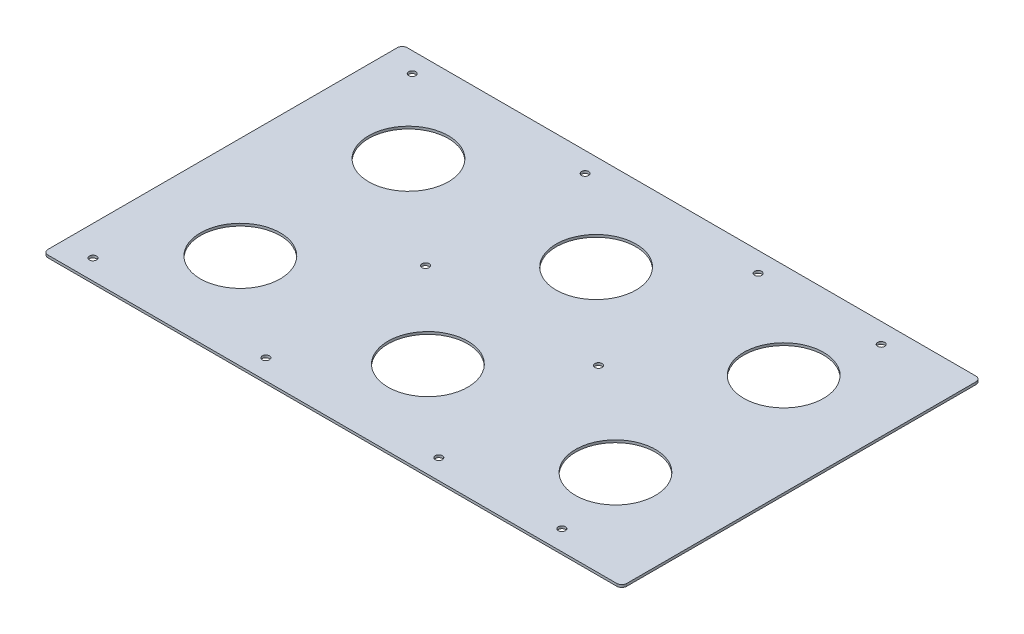
from build123d import *

# Parameters (mm, degrees)
SKETCH1_R           = 25.4
SKETCH1_R_2         = 2.2479
BOSS_EXTRUDE1_DEPTH = 1.5748


with BuildPart() as part:
    # Sketch1 → Boss-Extrude1 (new body)
    with BuildSketch(Plane(origin=(0, 0, 0), x_dir=(1, 0, 0), z_dir=(0, 1, 0))):
        with BuildLine():
            Line((-180.975, -114.3), (180.975, -114.3))
            ThreePointArc((180.975, -114.3), (183.22006403, -113.37006403), (184.15, -111.125))
            Line((184.15, -111.125), (184.15, 111.125))
            ThreePointArc((184.15, 111.125), (183.22006403, 113.37006403), (180.975, 114.3))
            Line((180.975, 114.3), (-180.975, 114.3))
            ThreePointArc((-180.975, 114.3), (-183.22006403, 113.37006403), (-184.15, 111.125))
            Line((-184.15, 111.125), (-184.15, -111.125))
            ThreePointArc((-184.15, -111.125), (-183.22006403, -113.37006403), (-180.975, -114.3))
        make_face()
        with Locations((119.38, 53.5178)):
            Circle(SKETCH1_R, mode=Mode.SUBTRACT)
        with Locations((-119.38, -53.5178)):
            Circle(SKETCH1_R, mode=Mode.SUBTRACT)
        with Locations((119.38, -53.5178)):
            Circle(SKETCH1_R, mode=Mode.SUBTRACT)
        with Locations((0, -53.5178)):
            Circle(SKETCH1_R, mode=Mode.SUBTRACT)
        with Locations((0, 53.5178)):
            Circle(SKETCH1_R, mode=Mode.SUBTRACT)
        with Locations((-119.38, 53.5178)):
            Circle(SKETCH1_R, mode=Mode.SUBTRACT)
        with Locations((55.033333333, -101.6)):
            Circle(SKETCH1_R_2, mode=Mode.SUBTRACT)
        with Locations((-55.033333333, -101.6)):
            Circle(SKETCH1_R_2, mode=Mode.SUBTRACT)
        with Locations((-165.1, -101.6)):
            Circle(SKETCH1_R_2, mode=Mode.SUBTRACT)
        with Locations((-55.033333333, 101.6)):
            Circle(SKETCH1_R_2, mode=Mode.SUBTRACT)
        with Locations((-165.1, 101.6)):
            Circle(SKETCH1_R_2, mode=Mode.SUBTRACT)
        with Locations((55.033333333, 101.6)):
            Circle(SKETCH1_R_2, mode=Mode.SUBTRACT)
        with Locations((55.033333333, 0)):
            Circle(SKETCH1_R_2, mode=Mode.SUBTRACT)
        with Locations((-55.033333333, 0)):
            Circle(SKETCH1_R_2, mode=Mode.SUBTRACT)
        with Locations((133.35, 101.6)):
            Circle(SKETCH1_R_2, mode=Mode.SUBTRACT)
        with Locations((133.35, -101.6)):
            Circle(SKETCH1_R_2, mode=Mode.SUBTRACT)
    extrude(amount=BOSS_EXTRUDE1_DEPTH)


solid = part.part
